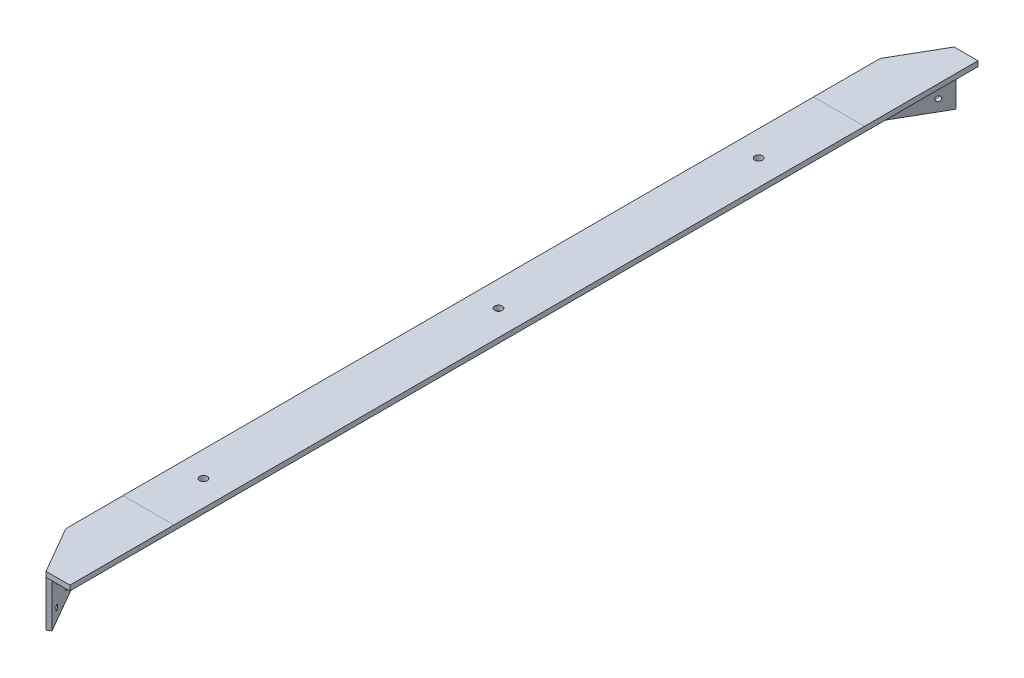
from build123d import *

# Parameters (mm, degrees)
BOSS_EXTRUDE1_DEPTH  = 640
BOSS_EXTRUDE2_DEPTH  = 8
BOSS_EXTRUDE3_DEPTH  = 72
SKETCH6_R            = 4
CUT_EXTRUDE1_DEPTH   = 8
FILLET1_R            = 10
FILLET2_R            = 8
FILLET1_OF_MIRROR1_R = 10
FILLET2_OF_MIRROR1_R = 8
SKETCH8_R            = 6
CUT_EXTRUDE2_DEPTH   = 8


with BuildPart() as part:
    # Sketch1 → Boss-Extrude1 (new body)
    with BuildSketch(Plane.XY):
        Polygon((-8, 8), (72, 8), (72, 0), (0, 0), (0, -72), (-8, -72), align=None)
    boss_extrude1 = extrude(amount=BOSS_EXTRUDE1_DEPTH)

    # Sketch3 → Boss-Extrude2 (add)
    with BuildSketch(Plane(origin=(0, 0, 0), x_dir=(1, 0, 0), z_dir=(0, 1, 0))):
        Polygon((-8, -640), (34.5, -713.612159322), (72, -713.612159322), (72, -640), align=None)
    boss_extrude2 = extrude(amount=BOSS_EXTRUDE2_DEPTH)

    # Sketch4 → Boss-Extrude3 (add)
    with BuildSketch(Plane.XZ):
        Polygon((-8, 640), (34.5, 713.612159322), (40.5, 710.148057707), (0, 640), align=None)
    boss_extrude3 = extrude(amount=BOSS_EXTRUDE3_DEPTH)

    # Sketch6 → Cut-Extrude1 (cut)
    with BuildSketch(Plane(origin=(-277.128129211, 0, 160), x_dir=(-0.4999999999999956, 0, -0.8660254037844413), z_dir=(0.8660254037844413, 0, -0.4999999999999956))):
        with Locations((-615.006258422, -18)):
            Circle(SKETCH6_R)
        with Locations((-574.506258422, -18)):
            Circle(SKETCH6_R)
        with Locations((-574.506258422, -54)):
            Circle(SKETCH6_R)
        with Locations((-615.006258422, -54)):
            Circle(SKETCH6_R)
    cut_extrude1 = extrude(amount=-CUT_EXTRUDE1_DEPTH, mode=Mode.SUBTRACT)

    # Fillet1
    fillet1_edges = [part.edges().sort_by_distance(p)[0] for p in [
        (-8, -32, 640),
        (0, -36, 640),
    ]]
    fillet(fillet1_edges, radius=FILLET1_R)

    # Fillet2
    fillet2_edges = [part.edges().sort_by_distance(p)[0] for p in [
        (0, 0, 318.660254038),
        (0.340741737, 0, 639.908698527),
        (20.919872981, 0, 676.234282891),
    ]]
    fillet(fillet2_edges, radius=FILLET2_R)

    # Mirror1: Boss-Extrude1, Boss-Extrude2, Boss-Extrude3, Cut-Extrude1 across plane
    add(boss_extrude1.mirror(Plane.XY))
    add(boss_extrude2.mirror(Plane.XY))
    add(boss_extrude3.mirror(Plane.XY))
    add(cut_extrude1.mirror(Plane.XY), mode=Mode.SUBTRACT)

    # Fillet1 of Mirror1
    fillet1_of_mirror1_edges = [part.edges().sort_by_distance(p)[0] for p in [
        (-8, -32, -640),
        (0, -36, -640),
    ]]
    fillet(fillet1_of_mirror1_edges, radius=FILLET1_OF_MIRROR1_R)

    # Fillet2 of Mirror1
    fillet2_of_mirror1_edges = [part.edges().sort_by_distance(p)[0] for p in [
        (0, 0, -318.660254038),
        (0.340741737, 0, -639.908698527),
        (20.919872981, 0, -676.234282891),
    ]]
    fillet(fillet2_of_mirror1_edges, radius=FILLET2_OF_MIRROR1_R)

    # Sketch8 → Cut-Extrude2 (cut)
    with BuildSketch(Plane(origin=(0, 8, 0), x_dir=(1, 0, 0), z_dir=(0, 1, 0))):
        with Locations((32, 408.88990362)):
            Circle(SKETCH8_R)
        with Locations((32, 0)):
            Circle(SKETCH8_R)
        with Locations((32, -463.612159322)):
            Circle(SKETCH8_R)
    extrude(amount=-CUT_EXTRUDE2_DEPTH, mode=Mode.SUBTRACT)


solid = part.part
